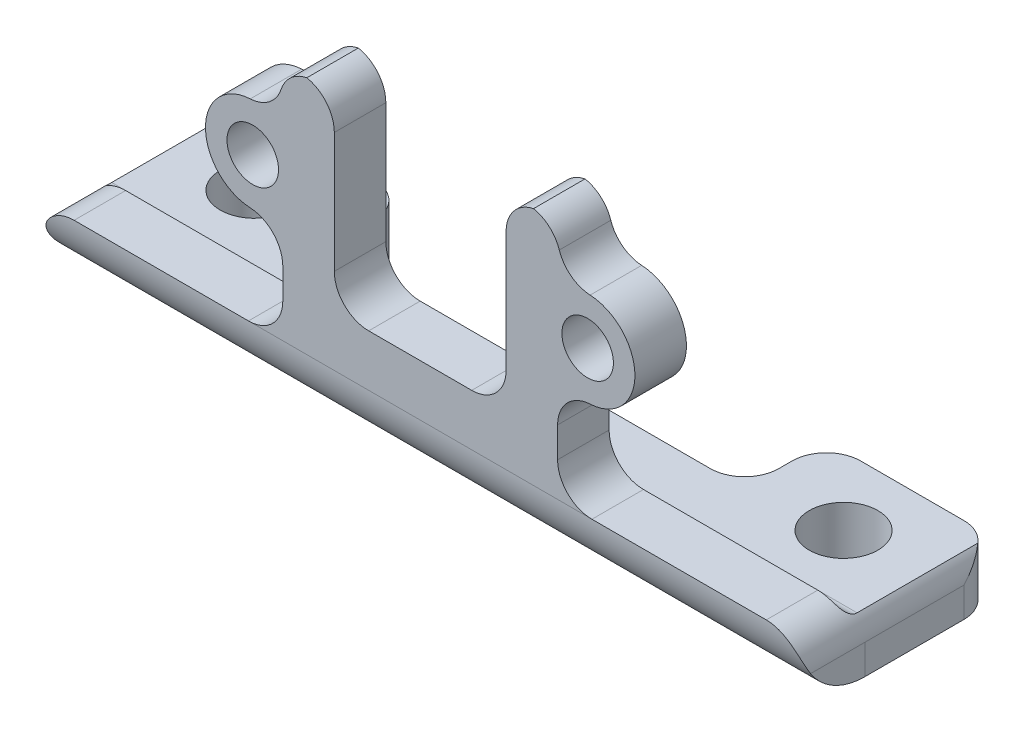
from build123d import *

# Parameters (mm, degrees)
ESBO_O23_W                     = 44.3
ESBO_O23_H                     = 11.5
ESBO_O23_R                     = 2
FLANGE_BASE2_DEPTH             = 3
ARESTA_FLANGE1_STRIP_W         = 13.4732
ARESTA_FLANGE1_STRIP_H         = 3
ARESTA_FLANGE1_STRIP_CUT_DEPTH = 44.3
ARESTA_FLANGE1_DEPTH           = 44.3
CORTE_EXTRUS_O1_REACH          = 41.939
CORTE_EXTRUS_O2_REACH          = 41.939
ESBO_O33_R                     = 1.5
ESBO_O33_W                     = 10
ESBO_O33_H                     = 11.0034
FILETE1_START                  = -5
FILETE1_DEPTH                  = 12.011168151
FILETE1_START_2                = 4.011168151
FILETE1_2_DEPTH                = 3
FILETE1_3_DEPTH                = 3
FILETE1_START_3                = -4
FILETE1_4_DEPTH                = 4.7366001
ESBO_O34_W                     = 24.3
ESBO_O34_H                     = 4.7634
CORTE_EXTRUS_O3_DEPTH          = 39.884804768
FILETE2_R                      = 2


with BuildPart() as part:
    # Flange-base2: sheet metal written as solids
    # Esboço23 → Flange-base2 (new body)
    with BuildSketch(Plane(origin=(0, 0, 0), x_dir=(1, 0, 0), z_dir=(0, 1, 0))):
        with Locations((13.143114832, -1.261168151)):
            Rectangle(ESBO_O23_W, ESBO_O23_H)
        with Locations(Location((-4.006885168, 0.488831849, 0), (0, 0, 270))):
            Circle(ESBO_O23_R, mode=Mode.SUBTRACT)
        with Locations(Location((30.293114832, 0.488831849, 0), (0, 0, 90))):
            Circle(ESBO_O23_R, mode=Mode.SUBTRACT)
    extrude(amount=-FLANGE_BASE2_DEPTH)

    # Aresta-Flange1: sheet metal written as solids
    # Aresta-Flange1 strip (on a plane across the edge) → Aresta-Flange1 strip cut (cut)
    with BuildSketch(Plane(origin=(-9.006885168, 0, 7.011168151), x_dir=(0, 0, -1), z_dir=(1, 0, 0))):
        with Locations((-3, -1.5)):
            Rectangle(ARESTA_FLANGE1_STRIP_W, ARESTA_FLANGE1_STRIP_H)
    extrude(amount=ARESTA_FLANGE1_STRIP_CUT_DEPTH, mode=Mode.SUBTRACT)

    # Aresta-Flange1 section (on a plane across the edge) → Aresta-Flange1 (add)
    with BuildSketch(Plane(origin=(-9.006885168, 0, 7.011168151), x_dir=(0, 0, -1), z_dir=(1, 0, 0))):
        with BuildLine():
            Line((0, 0.7366), (0, 14.74))
            Line((0, 14.74), (3, 14.74))
            Line((3, 14.74), (3, 0.7366))
            ThreePointArc((3, 0.7366), (3.215745145, 0.215745145), (3.7366, 0))
            Line((3.7366, 0), (3.7366, -3))
            ThreePointArc((3.7366, -3), (1.094424801, -1.905575199), (0, 0.7366))
        make_face()
    extrude(amount=ARESTA_FLANGE1_DEPTH)

    # Esboço31 → Corte-extrusão1 (cut, up to next)
    with BuildSketch(Plane.XY.offset(7.011168151), mode=Mode.PRIVATE) as corte_extrus_o1_sk1:
        with BuildLine():
            Line((5.143114832, 14.74), (5.143114832, 11.99))
            Line((5.143114832, 11.99), (3.393114832, 11.99))
            ThreePointArc((3.393114832, 11.99), (0.641414832, 9.2383), (3.393114832, 6.4866))
            Line((3.393114832, 6.4866), (5.143114832, 6.4866))
            Line((5.143114832, 6.4866), (5.143114832, 0.7366))
            Line((5.143114832, 0.7366), (-9.006885168, 0.7366))
            Line((-9.006885168, 0.7366), (-9.006885168, 14.74))
            Line((-9.006885168, 14.74), (5.143114832, 14.74))
        make_face()
    corte_extrus_o1_tool1 = extrude(corte_extrus_o1_sk1.sketch, amount=-CORTE_EXTRUS_O1_REACH, mode=Mode.PRIVATE) & part.part
    # Esboço31 → Corte-extrusão1 (cut, up to next)
    with BuildSketch(Plane.XY.offset(7.011168151), mode=Mode.PRIVATE) as corte_extrus_o1_sk2:
        with BuildLine():
            Line((21.143114832, 6.4866), (21.143114832, 0.7366))
            Line((21.143114832, 0.7366), (35.293114832, 0.7366))
            Line((35.293114832, 0.7366), (35.293114832, 14.74))
            Line((35.293114832, 14.74), (21.143114832, 14.74))
            Line((21.143114832, 14.74), (21.143114832, 11.99))
            Line((21.143114832, 11.99), (22.893114832, 11.99))
            ThreePointArc((22.893114832, 11.99), (25.644814832, 9.2383), (22.893114832, 6.4866))
            Line((22.893114832, 6.4866), (21.143114832, 6.4866))
        make_face()
    corte_extrus_o1_tool2 = extrude(corte_extrus_o1_sk2.sketch, amount=-CORTE_EXTRUS_O1_REACH, mode=Mode.PRIVATE) & part.part
    add(corte_extrus_o1_tool1.solids().sort_by_distance((-2.549902, 7.555498, 7.011168))[0], mode=Mode.SUBTRACT)
    add(corte_extrus_o1_tool2.solids().sort_by_distance((28.836132, 7.555498, 7.011168))[0], mode=Mode.SUBTRACT)

    # Esboço33 → Corte-extrusão2 (cut, up to next)
    with BuildSketch(Plane.XY.offset(7.011168151), mode=Mode.PRIVATE) as corte_extrus_o2_sk1:
        with Locations((3.393114832, 9.2383)):
            Circle(ESBO_O33_R)
    corte_extrus_o2_tool1 = extrude(corte_extrus_o2_sk1.sketch, amount=-CORTE_EXTRUS_O2_REACH, mode=Mode.PRIVATE) & part.part
    # Esboço33 → Corte-extrusão2 (cut, up to next)
    with BuildSketch(Plane.XY.offset(7.011168151), mode=Mode.PRIVATE) as corte_extrus_o2_sk2:
        with Locations(Location((22.893114832, 9.2383, 0), (0, 0, 180))):
            Circle(ESBO_O33_R)
    corte_extrus_o2_tool2 = extrude(corte_extrus_o2_sk2.sketch, amount=-CORTE_EXTRUS_O2_REACH, mode=Mode.PRIVATE) & part.part
    # Esboço33 → Corte-extrusão2 (cut, up to next)
    with BuildSketch(Plane.XY.offset(7.011168151), mode=Mode.PRIVATE) as corte_extrus_o2_sk3:
        with Locations((13.143114832, 9.2383)):
            Rectangle(ESBO_O33_W, ESBO_O33_H)
    corte_extrus_o2_tool3 = extrude(corte_extrus_o2_sk3.sketch, amount=-CORTE_EXTRUS_O2_REACH, mode=Mode.PRIVATE) & part.part
    add(corte_extrus_o2_tool1.solids().sort_by_distance((3.393115, 9.2383, 7.011168))[0], mode=Mode.SUBTRACT)
    add(corte_extrus_o2_tool2.solids().sort_by_distance((22.893115, 9.2383, 7.011168))[0], mode=Mode.SUBTRACT)
    add(corte_extrus_o2_tool3.solids().sort_by_distance((13.143115, 9.2383, 7.011168))[0], mode=Mode.SUBTRACT)

    # Filete1: read off the stored shape, not the designer's step
    # Filete1 outline → Filete1 (cut)
    with BuildSketch(Plane.XY.offset(FILETE1_START)):
        with BuildLine():
            Line((-9.006885168, 0.7366), (-9.006885168, -1.2634))
            ThreePointArc((-9.006885168, -1.2634), (-8.42109873, 0.150813562), (-7.006885168, 0.7366))
            Line((-7.006885168, 0.7366), (-9.006885168, 0.7366))
        make_face()
        with BuildLine():
            ThreePointArc((33.293114832, 0.7366), (34.707328395, 0.150813562), (35.293114832, -1.2634))
            Line((35.293114832, -1.2634), (35.293114832, 0.7366))
            Line((35.293114832, 0.7366), (33.293114832, 0.7366))
        make_face()
    extrude(amount=FILETE1_DEPTH, mode=Mode.SUBTRACT)

    # Filete1 2 outline → Filete1 2 (add)
    with BuildSketch(Plane.XY.offset(FILETE1_START_2)):
        with BuildLine():
            ThreePointArc((5.143114832, 2.7366), (4.557328394, 1.322386438), (3.143114832, 0.7366))
            Line((3.143114832, 0.7366), (5.143114832, 0.7366))
            Line((5.143114832, 0.7366), (5.143114832, 2.7366))
        make_face()
        with BuildLine():
            Line((21.143114832, 0.7366), (23.143114832, 0.7366))
            ThreePointArc((23.143114832, 0.7366), (21.72890127, 1.322386438), (21.143114832, 2.7366))
            Line((21.143114832, 2.7366), (21.143114832, 0.7366))
        make_face()
        with BuildLine():
            Line((8.143114832, 3.7366), (10.143114832, 3.7366))
            ThreePointArc((10.143114832, 3.7366), (8.72890127, 4.322386438), (8.143114832, 5.7366))
            Line((8.143114832, 5.7366), (8.143114832, 3.7366))
        make_face()
        with BuildLine():
            ThreePointArc((18.143114832, 5.7366), (17.557328394, 4.322386437), (16.143114832, 3.7366))
            Line((16.143114832, 3.7366), (18.143114832, 3.7366))
            Line((18.143114832, 3.7366), (18.143114832, 5.7366))
        make_face()
    extrude(amount=FILETE1_2_DEPTH)

    # Filete1 3 outline → Filete1 3 (add)
    with BuildSketch(Plane.XY.offset(FILETE1_START_2)):
        with BuildLine():
            ThreePointArc((22.893114832, 11.99), (22.96552716, 11.989047052), (23.037889334, 11.986188868))
            ThreePointArc((23.037889334, 11.986188868), (21.69217531, 12.606910766), (21.143114832, 13.983418849))
            Line((21.143114832, 13.983418849), (21.143114832, 11.99))
            Line((21.143114832, 11.99), (22.893114832, 11.99))
        make_face()
        with BuildLine():
            ThreePointArc((21.143114832, 4.493181151), (21.69217531, 5.869689234), (23.037889334, 6.490411131))
            ThreePointArc((23.037889334, 6.490411131), (22.96552716, 6.487552948), (22.893114832, 6.4866))
            Line((22.893114832, 6.4866), (21.143114832, 6.4866))
            Line((21.143114832, 6.4866), (21.143114832, 4.493181151))
        make_face()
        with BuildLine():
            ThreePointArc((5.143114832, 13.983418849), (4.594054355, 12.606910766), (3.248340331, 11.986188869))
            ThreePointArc((3.248340331, 11.986188869), (3.320702504, 11.989047052), (3.393114832, 11.99))
            Line((3.393114832, 11.99), (5.143114832, 11.99))
            Line((5.143114832, 11.99), (5.143114832, 13.983418849))
        make_face()
        with BuildLine():
            ThreePointArc((3.248340331, 6.490411131), (4.594054355, 5.869689234), (5.143114832, 4.493181151))
            Line((5.143114832, 4.493181151), (5.143114832, 6.4866))
            Line((5.143114832, 6.4866), (3.393114832, 6.4866))
            ThreePointArc((3.393114832, 6.4866), (3.320702504, 6.487552948), (3.248340331, 6.490411131))
        make_face()
    extrude(amount=FILETE1_3_DEPTH)

    # Filete1 4 outline → Filete1 4 (cut)
    with BuildSketch(Plane(origin=(0, 0, 0), x_dir=(1, 0, 0), z_dir=(0, 1, 0)).offset(FILETE1_START_3)):
        with BuildLine():
            Line((35.293114832, 4.488831849), (33.293114832, 4.488831849))
            ThreePointArc((33.293114832, 4.488831849), (34.707328395, 3.903045412), (35.293114832, 2.488831849))
            Line((35.293114832, 2.488831849), (35.293114832, 4.488831849))
        make_face()
        with BuildLine():
            ThreePointArc((-9.006885168, 2.488831849), (-8.421098731, 3.903045412), (-7.006885168, 4.488831849))
            Line((-7.006885168, 4.488831849), (-9.006885168, 4.488831849))
            Line((-9.006885168, 4.488831849), (-9.006885168, 2.488831849))
        make_face()
    extrude(amount=FILETE1_4_DEPTH, mode=Mode.SUBTRACT)

    # Esboço34 → Corte-extrusão3 (cut, through all)
    with BuildSketch(Plane(origin=(0, 0, 0), x_dir=(1, 0, 0), z_dir=(0, 1, 0))):
        with Locations((13.143114832, 2.107131849)):
            Rectangle(ESBO_O34_W, ESBO_O34_H)
    extrude(amount=-CORTE_EXTRUS_O3_DEPTH, mode=Mode.SUBTRACT)

    # Filete2
    # the kernel refuses this fillet: 2 mm, written as the material it adds along each edge
    with BuildSketch(Plane(origin=(0.993114832, 0, 0.274568151), x_dir=(0, 0, -1), z_dir=(0, -1, 0))) as filete2_piece_1:
        with BuildLine():
            CenterArc((FILETE2_R, FILETE2_R), FILETE2_R, 180, 90)
            Line((0, FILETE2_R), (0, 0))
            Line((0, 0), (FILETE2_R, 0))
        make_face()
    extrude(amount=3)
    with BuildSketch(Plane(origin=(25.293114832, 0, 0.274568151), x_dir=(0, 0, -1), z_dir=(0, -1, 0))) as filete2_piece_2:
        with BuildLine():
            CenterArc((FILETE2_R, -FILETE2_R), FILETE2_R, 90, 90)
            Line((0, -FILETE2_R), (0, 0))
            Line((0, 0), (FILETE2_R, 0))
        make_face()
    extrude(amount=3)
    # the kernel refuses this fillet: 2 mm, written as the material it takes off along each edge
    with BuildSketch(Plane(origin=(5.143114832, 14.74, 11.515742565), x_dir=(1, 0, 0), z_dir=(0, 0, -1))) as filete2_2_piece_1:
        with BuildLine():
            CenterArc((1.801829766, 2), FILETE2_R, 198.110746947, 71.889253053)
            Line((-0.099085117, 1.378290576), (-0.289176606, 1.316119634))
            ThreePointArc((-0.289176606, 1.316119634), (-0.2, 0.756581151), (-0.2, 0))
            Line((-0.2, 0), (0, -0.2))
            Line((0, -0.2), (1.801829766, -0.2))
            Line((1.801829766, -0.2), (1.801829766, 0))
        make_face()
    extrude(amount=12.009148828, mode=Mode.SUBTRACT)
    with BuildSketch(Plane(origin=(21.143114832, 14.74, 11.515742565), x_dir=(0.07170480855584176, -0.9974258972124044, 0), z_dir=(0, 0, -1))) as filete2_2_piece_2:
        with BuildLine():
            CenterArc((1.865651936, 1.940601288), FILETE2_R, 184.111911668, 71.889253032)
            Line((-0.129199858, 1.797191671), (-0.328685038, 1.782850709))
            Line((-0.328685038, 1.782850709), (-0.199485179, -0.014340962))
            Line((-0.199485179, -0.014340962), (0.014340962, -0.199485179))
            ThreePointArc((0.014340962, -0.199485179), (0.768974595, -0.145234673), (1.333467159, -0.194060129))
            Line((1.333467159, -0.194060129), (1.381847593, 0))
        make_face()
    extrude(amount=12.009148828, mode=Mode.SUBTRACT)
    with BuildSketch(Plane(origin=(8.143114832, 14.74, 12.011168151), x_dir=(0, -1, 0), z_dir=(0, 0, -1)), Plane(origin=(18.143114832, 14.74, 12.011168151), x_dir=(1, 0, 0), z_dir=(0, 0, -1)), Plane(origin=(25.293114832, 5, -4.488831849), x_dir=(1, 0, 0), z_dir=(0, -1, 0))) as filete2_2_piece_3:
        with BuildLine():
            CenterArc((FILETE2_R, FILETE2_R), FILETE2_R, 180, 90)
            Line((0, FILETE2_R), (0, 0))
            Line((0, 0), (FILETE2_R, 0))
        make_face()
    extrude(amount=13, mode=Mode.SUBTRACT)
    with BuildSketch(Plane(origin=(0.993114832, 5, -4.488831849), x_dir=(-1, 0, 0), z_dir=(0, -1, 0))) as filete2_2_piece_4:
        with BuildLine():
            CenterArc((FILETE2_R, -FILETE2_R), FILETE2_R, 90, 90)
            Line((0, -FILETE2_R), (0, 0))
            Line((0, 0), (FILETE2_R, 0))
        make_face()
    extrude(amount=13, mode=Mode.SUBTRACT)


solid = part.part
